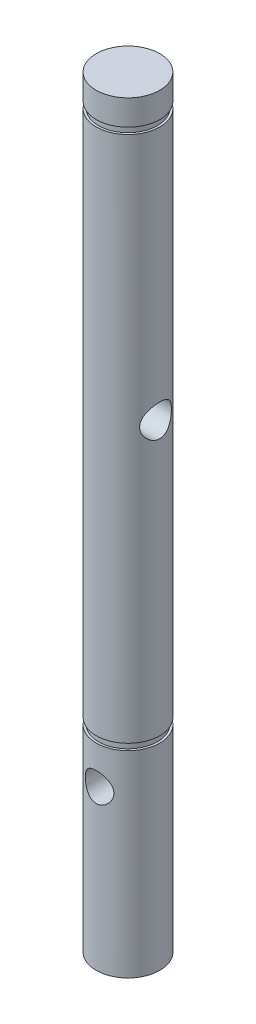
from build123d import *

# Parameters (mm, degrees)
SKETCH1_R               = 5
BOSS_EXTRUDE1_DEPTH     = 60
CUT_EXTRUDE2_DEPTH      = 61.415229868
CUT_EXTRUDE2_DEPTH_BACK = 61.415229868
SKETCH3_R               = 2.25
SKETCH4_R               = 5
SKETCH4_R_2             = 4.65
CUT_EXTRUDE3_DEPTH      = 1
CUT_EXTRUDE4_START      = 1
SKETCH5_R               = 5
SKETCH5_R_2             = 4.65
CUT_EXTRUDE4_DEPTH      = 1
CUT_EXTRUDE5_DEPTH      = 61.415229984
CUT_EXTRUDE5_DEPTH_BACK = 61.415229984
SKETCH6_R               = 2.5


with BuildPart() as part:
    # Sketch1 → Boss-Extrude1 (new, symmetric)
    with BuildSketch(Plane(origin=(0, 0, 0), x_dir=(1, 0, 0), z_dir=(0, 1, 0))):
        Circle(SKETCH1_R)
    extrude(amount=BOSS_EXTRUDE1_DEPTH, both=True)

    # Sketch3 → Cut-Extrude2 (cut, two sides: drawn at the far end of the back side and taken through both)
    with BuildSketch(Plane.XY.offset(-CUT_EXTRUDE2_DEPTH_BACK)):
        with Locations((0, -35)):
            Circle(SKETCH3_R)
    extrude(amount=CUT_EXTRUDE2_DEPTH + CUT_EXTRUDE2_DEPTH_BACK, mode=Mode.SUBTRACT)

    # Sketch4 → Cut-Extrude3 (cut)
    with BuildSketch(Plane(origin=(0, -28, 0), x_dir=(-1, 0, 0), z_dir=(0, -1, 0))):
        Circle(SKETCH4_R)
        Circle(SKETCH4_R_2, mode=Mode.SUBTRACT)
    extrude(amount=CUT_EXTRUDE3_DEPTH, mode=Mode.SUBTRACT)

    # Sketch5 → Cut-Extrude4 (cut)
    with BuildSketch(Plane(origin=(0, 55, 0), x_dir=(1, 0, 0), z_dir=(0, 1, 0)).offset(CUT_EXTRUDE4_START)):
        Circle(SKETCH5_R)
        Circle(SKETCH5_R_2, mode=Mode.SUBTRACT)
    extrude(amount=-CUT_EXTRUDE4_DEPTH, mode=Mode.SUBTRACT)

    # Sketch6 → Cut-Extrude5 (cut, two sides: drawn at the far end of the back side and taken through both)
    with BuildSketch(Plane(origin=(0, 0, 0), x_dir=(0, 0, -1), z_dir=(1, 0, 0)).offset(-CUT_EXTRUDE5_DEPTH_BACK)):
        with Locations((0, 15)):
            Circle(SKETCH6_R)
    extrude(amount=CUT_EXTRUDE5_DEPTH + CUT_EXTRUDE5_DEPTH_BACK, mode=Mode.SUBTRACT)


solid = part.part
